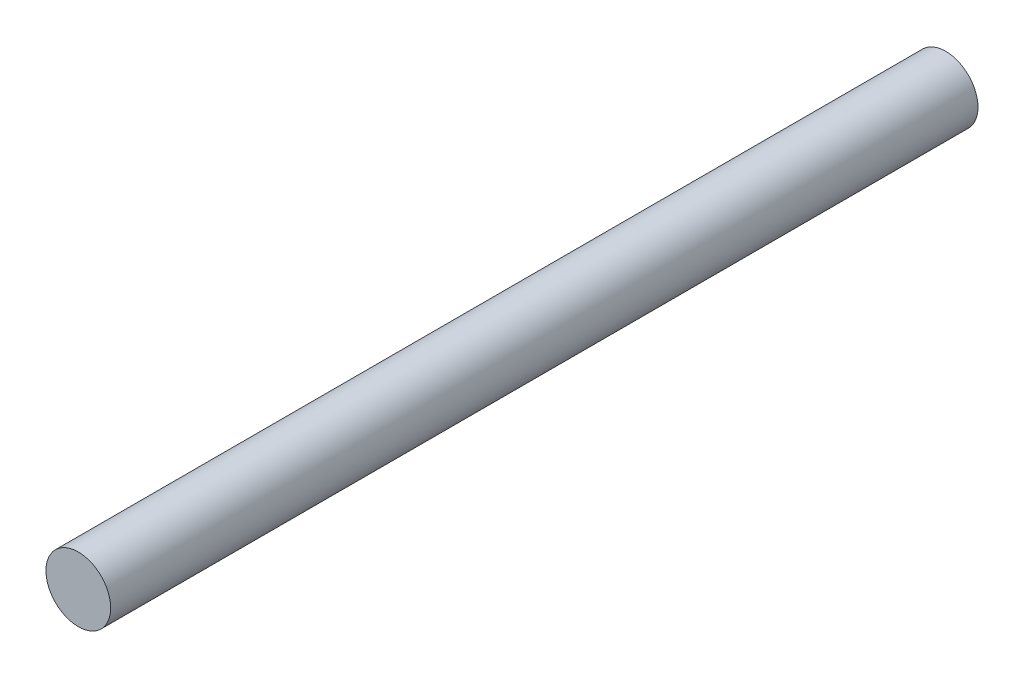
from build123d import *

# Parameters (mm, degrees)
SKETCH2_R           = 6.35
BOSS_EXTRUDE1_DEPTH = 170.18


with BuildPart() as part:
    # Sketch2 → Boss-Extrude1 (new body)
    with BuildSketch(Plane.XY):
        Circle(SKETCH2_R)
    extrude(amount=BOSS_EXTRUDE1_DEPTH)


solid = part.part
